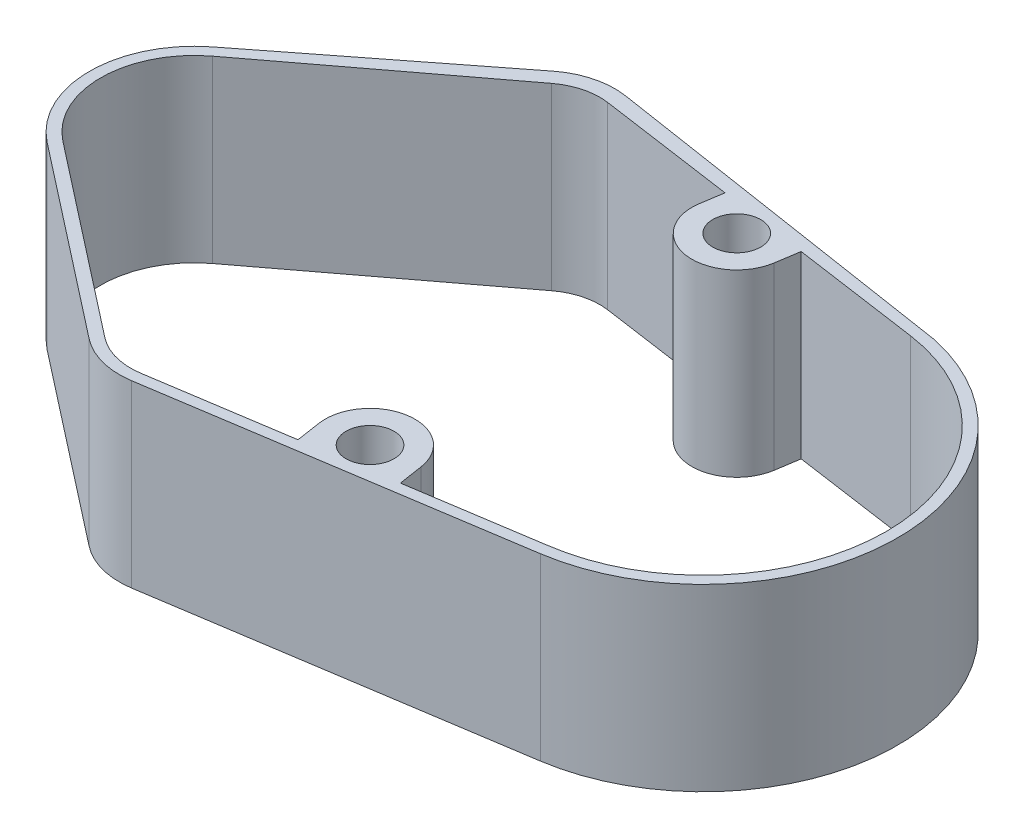
from build123d import *
from build123d.topology import SkipClean

# Parameters (mm, degrees)
SKETCH1_R               = 1.6
SKETCH1_R_2             = 1
SKETCH1_R_3             = 5.5
SKETCH1_R_4             = 4.5
BOSS_EXTRUDE2_DEPTH     = 2
BOSS_EXTRUDE3_START     = -2
SKETCH2_R               = 1
BOSS_EXTRUDE3_DEPTH     = 2
SKETCH3_R               = 1
CUT_EXTRUDE1_DEPTH      = 103
BOSS_EXTRUDE4_OUTLINE_R = 1
BOSS_EXTRUDE4_DEPTH     = 10
SKETCH5_R               = 87.063932705
CUT_EXTRUDE2_DEPTH      = 2
SKETCH6_R               = 1
BOSS_EXTRUDE5_DEPTH     = 2
SKETCH7_R               = 1.6
BOSS_EXTRUDE6_DEPTH     = 12
SKETCH8_R               = 1.6
CUT_EXTRUDE3_DEPTH      = 12


# Read off the part's stored shape, not the designer's step: Boss-Extrude4
with BuildPart() as part:
    # Sketch1 → Boss-Extrude2 (new body)
    with BuildSketch(Plane(origin=(0, 0, 0), x_dir=(1, 0, 0), z_dir=(0, 1, 0))):
        with BuildLine():
            Line((12.313589515, -16.493996637), (35.979225245, -12.848450001))
            ThreePointArc((35.979225245, -12.848450001), (46.993067566, -0.424494085), (36.813648041, 12.691862933))
            Line((36.813648041, 12.691862933), (35.165189196, 12.947676785))
            Line((35.165189196, 12.947676785), (12.319067304, 16.493021261))
            ThreePointArc((12.319067304, 16.493021261), (11.720527595, 16.549330191), (11.119556233, 16.533395936))
            Line((11.119556233, 16.533395936), (-11.812019178, 14.541098507))
            ThreePointArc((-11.812019178, 14.541098507), (-13.247239988, 14.027709898), (-14.244912332, 12.87528787))
            Line((-14.244912332, 12.87528787), (-19.487592157, 2.204884721))
            ThreePointArc((-19.487592157, 2.204884721), (-19.693653105, -1.723258696), (-16.994761113, -4.584858569))
            Line((-16.994761113, -4.584858569), (9.557587922, -16.137143667))
            ThreePointArc((9.557587922, -16.137143667), (10.910298182, -16.51089082), (12.313589515, -16.493996637))
        make_face()
        with Locations(Location((11.552349036, -11.552285098, 0), (0, 0, 270))):
            Circle(SKETCH1_R, mode=Mode.SUBTRACT)
        with Locations(Location((25, -11, 0), (0, 0, 270))):
            Circle(SKETCH1_R_2, mode=Mode.SUBTRACT)
        with Locations(Location((-15, 0, 0), (0, 0, 270))):
            Circle(SKETCH1_R, mode=Mode.SUBTRACT)
        with Locations(Location((0, 0, 0), (0, 0, 270))):
            Circle(SKETCH1_R_3, mode=Mode.SUBTRACT)
        with Locations(Location((-11.552357038, 11.552357038, 0), (0, 0, 270))):
            Circle(SKETCH1_R, mode=Mode.SUBTRACT)
        with Locations(Location((11.552326466, 11.552160153, 0), (0, 0, 270))):
            Circle(SKETCH1_R, mode=Mode.SUBTRACT)
        with Locations(Location((14, 0, 0), (0, 0, 270))):
            Circle(SKETCH1_R_4, mode=Mode.SUBTRACT)
        with Locations(Location((34, 0, 0), (0, 0, 270))):
            Circle(SKETCH1_R_4, mode=Mode.SUBTRACT)
        with Locations(Location((25, 11, 0), (0, 0, 270))):
            Circle(SKETCH1_R_2, mode=Mode.SUBTRACT)
    extrude(amount=BOSS_EXTRUDE2_DEPTH)

    # Sketch2 → Boss-Extrude3 (add)
    with BuildSketch(Plane(origin=(0, 2, 0), x_dir=(1, 0, 0), z_dir=(0, 1, 0)).offset(BOSS_EXTRUDE3_START)):
        with Locations((25, 11)):
            Circle(SKETCH2_R)
        with Locations((25, -11)):
            Circle(SKETCH2_R)
    extrude(amount=BOSS_EXTRUDE3_DEPTH)

    # Sketch3 → Cut-Extrude1 (cut)
    with BuildSketch(Plane(origin=(0, 2, 0), x_dir=(1, 0, 0), z_dir=(0, 1, 0))):
        with Locations(Location((24, 13, 0), (0, 0, 270))):
            Circle(SKETCH3_R)
        with Locations(Location((24, -13, 0), (0, 0, 270))):
            Circle(SKETCH3_R)
    extrude(amount=-CUT_EXTRUDE1_DEPTH, mode=Mode.SUBTRACT)

    # Boss-Extrude4 outline → Boss-Extrude4 (add)
    with SkipClean():  # the faces are left unmerged after this step: merging them gives an invalid solid
        with BuildSketch(Plane(origin=(0, 2, 0), x_dir=(1, 0, 0), z_dir=(0, 1, 0))):
            with BuildLine():
                ThreePointArc((8.453372169, -15.47610242), (10.277484332, -16.387026041), (12.313589515, -16.493996637))
                Line((12.313589515, -16.493996637), (35.979225245, -12.848450001))
                ThreePointArc((35.979225245, -12.848450001), (46.993067566, -0.424494085), (36.813648041, 12.691862933))
                Line((36.813648041, 12.691862933), (12.319067304, 16.493021261))
                ThreePointArc((12.319067304, 16.493021261), (10.294223964, 16.391290043), (8.476229775, 15.493940099))
                Line((8.476229775, 15.493940099), (-4.306535369, 5.518491924))
                ThreePointArc((-4.306535369, 5.518491924), (-7, 0), (-4.306535369, -5.518491924))
                Line((-4.306535369, -5.518491924), (8.453372169, -15.47610242))
            make_face()
            with Locations((24, -13)):
                Circle(BOSS_EXTRUDE4_OUTLINE_R, mode=Mode.SUBTRACT)
            with BuildLine():
                Line((35.738243971, -12.126046672), (26.117255626, -13.608064851))
                Line((26.117255626, -13.608064851), (25.976685738, -12.695511096))
                ThreePointArc((25.976685738, -12.695511096), (23.695511096, -11.023314262), (22.023314262, -13.304488904))
                Line((22.023314262, -13.304488904), (22.16388415, -14.217042659))
                Line((22.16388415, -14.217042659), (12.27862862, -15.739768587))
                ThreePointArc((12.27862862, -15.739768587), (10.519552717, -15.67488522), (8.937649363, -14.902784407))
                Line((8.937649363, -14.902784407), (-3.845146577, -4.927204867))
                ThreePointArc((-3.845146577, -4.927204867), (-6.249813783, 0.048245957), (-3.768620923, 4.985979978))
                Line((-3.768620923, 4.985979978), (9.140409076, 14.743187339))
                ThreePointArc((9.140409076, 14.743187339), (10.553310252, 15.425397379), (12.119916334, 15.511685597))
                Line((12.119916334, 15.511685597), (22.133828609, 14.076211769))
                Line((22.133828609, 14.076211769), (22.020237278, 13.283794934))
                ThreePointArc((22.020237278, 13.283794934), (23.716205066, 11.020237278), (25.979762722, 12.716205066))
                Line((25.979762722, 12.716205066), (26.093354053, 13.508621901))
                Line((26.093354053, 13.508621901), (35.738243971, 12.126046672))
                ThreePointArc((35.738243971, 12.126046672), (46.25, 0), (35.738243971, -12.126046672))
            make_face(mode=Mode.SUBTRACT)
            with Locations((24, 13)):
                Circle(BOSS_EXTRUDE4_OUTLINE_R, mode=Mode.SUBTRACT)
        extrude(amount=BOSS_EXTRUDE4_DEPTH)
    add(part.part.scale(1), mode=Mode.REPLACE)  # the faces are merged on a copy

    # Sketch5 → Cut-Extrude2 (cut)
    with BuildSketch(Plane(origin=(0, 0, 0), x_dir=(-1, 0, 0), z_dir=(0, -1, 0))):
        Circle(SKETCH5_R)
    extrude(amount=-CUT_EXTRUDE2_DEPTH, mode=Mode.SUBTRACT)

    # Sketch6 → Boss-Extrude5 (add)
    with SkipClean():  # the faces are left unmerged after this step: merging them gives an invalid solid
        with BuildSketch(Plane(origin=(0, 12, 0), x_dir=(1, 0, 0), z_dir=(0, 1, 0))):
            with BuildLine():
                Line((-4.306535369, 5.518491924), (8.476229775, 15.493940099))
                ThreePointArc((8.476229775, 15.493940099), (10.294223964, 16.391290043), (12.319067304, 16.493021261))
                Line((12.319067304, 16.493021261), (36.813648041, 12.691862933))
                ThreePointArc((36.813648041, 12.691862933), (46.993067566, -0.424494085), (35.979225245, -12.848450001))
                Line((35.979225245, -12.848450001), (12.313589515, -16.493996637))
                ThreePointArc((12.313589515, -16.493996637), (10.277484331, -16.387026041), (8.453372169, -15.47610242))
                Line((8.453372169, -15.47610242), (-4.306535369, -5.518491924))
                ThreePointArc((-4.306535369, -5.518491924), (-7, 0), (-4.306535369, 5.518491924))
            make_face()
            with Locations(Location((24, -13, 0), (0, 0, 270))):
                Circle(SKETCH6_R, mode=Mode.SUBTRACT)
            with Locations(Location((24, 13, 0), (0, 0, 270))):
                Circle(SKETCH6_R, mode=Mode.SUBTRACT)
            with BuildLine():
                Line((35.738243971, 12.126046672), (26.093354053, 13.508621901))
                Line((26.093354053, 13.508621901), (25.979762722, 12.716205066))
                ThreePointArc((25.979762722, 12.716205066), (23.716205066, 11.020237278), (22.020237278, 13.283794934))
                Line((22.020237278, 13.283794934), (22.133828609, 14.076211769))
                Line((22.133828609, 14.076211769), (12.119916334, 15.511685597))
                ThreePointArc((12.119916334, 15.511685597), (10.553310252, 15.425397379), (9.140409076, 14.743187339))
                Line((9.140409076, 14.743187339), (-3.768620923, 4.985979978))
                ThreePointArc((-3.768620923, 4.985979978), (-6.249813783, 0.048245957), (-3.845146577, -4.927204867))
                Line((-3.845146577, -4.927204867), (8.937649363, -14.902784407))
                ThreePointArc((8.937649363, -14.902784407), (10.519552717, -15.67488522), (12.27862862, -15.739768587))
                Line((12.27862862, -15.739768587), (22.16388415, -14.217042659))
                Line((22.16388415, -14.217042659), (22, -13))
                ThreePointArc((22, -13), (23.847309916, -11.005837083), (25.976685738, -12.695511096))
                Line((25.976685738, -12.695511096), (26.117255626, -13.608064851))
                Line((26.117255626, -13.608064851), (35.738243971, -12.126046672))
                ThreePointArc((35.738243971, -12.126046672), (46.25, 0), (35.738243971, 12.126046672))
            make_face(mode=Mode.SUBTRACT)
        extrude(amount=BOSS_EXTRUDE5_DEPTH)

    # Sketch7 → Boss-Extrude6 (add)
    # profile 1 of 2: a face of its own
    with BuildSketch(Plane(origin=(0, 14, 0), x_dir=(1, 0, 0), z_dir=(0, 1, 0))):
        with BuildLine():
            Line((22.591660568, 14.898882792), (26.144897094, 14.347478595))
            Line((26.144897094, 14.347478595), (27.332795496, 14.163136191))
            Line((27.332795496, 14.163136191), (26.964516665, 11.789955497))
            ThreePointArc((26.964516665, 11.789955497), (23.539955497, 9.285483335), (21.035483335, 12.710044503))
            Line((21.035483335, 12.710044503), (21.403762166, 15.083225196))
            Line((21.403762166, 15.083225196), (22.591660568, 14.898882792))
        make_face()
        with Locations((24, 12.25)):
            Circle(SKETCH7_R, mode=Mode.SUBTRACT)
    # profile 2 of 2: a face of its own
    with BuildSketch(Plane(origin=(0, 14, 0), x_dir=(1, 0, 0), z_dir=(0, 1, 0))):
        with BuildLine():
            Line((26.126412864, -14.366215568), (21.402696028, -15.093875294))
            Line((21.402696028, -15.093875294), (21.034973077, -12.706744287))
            ThreePointArc((21.034973077, -12.706744287), (23.543255713, -9.284973077), (26.965026923, -11.793255713))
            Line((26.965026923, -11.793255713), (27.332749874, -14.18038672))
            Line((27.332749874, -14.18038672), (26.126412864, -14.366215568))
        make_face()
        with Locations((24, -12.25)):
            Circle(SKETCH7_R, mode=Mode.SUBTRACT)
    extrude(amount=-BOSS_EXTRUDE6_DEPTH)

    # Sketch8 → Cut-Extrude3 (cut)
    with BuildSketch(Plane(origin=(0, 14, 0), x_dir=(1, 0, 0), z_dir=(0, 1, 0))):
        with Locations(Location((24, -12.25, 0), (0, 0, 270))):
            Circle(SKETCH8_R)
        with Locations(Location((24, 12.25, 0), (0, 0, 270))):
            Circle(SKETCH8_R)
    extrude(amount=-CUT_EXTRUDE3_DEPTH, mode=Mode.SUBTRACT)


solid = part.part
